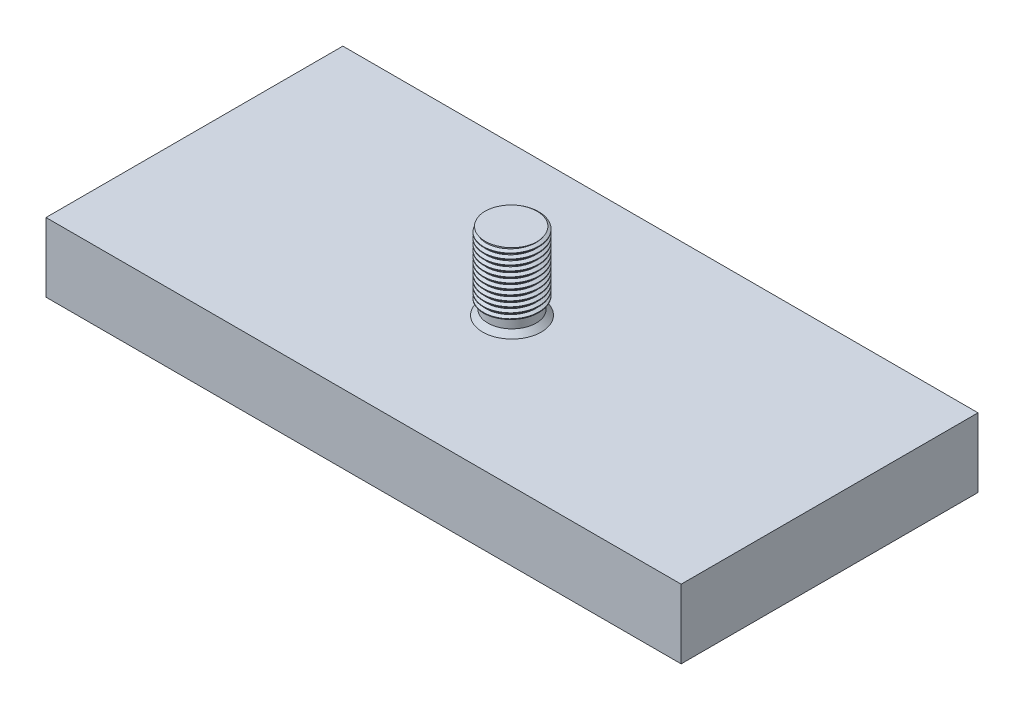
from build123d import *

# Parameters (mm, degrees)
SKETCH1_W          = 184
SKETCH1_H          = 86
PLATE_DEPTH        = 20
SKETCH2_R          = 7
NECK_DEPTH         = 4
SKETCH3_R          = 8
BOLT_DEPTH         = 18
M16_THREAD_PITCH   = 1.5
WELDINGCORNER_SIZE = 1.5


with BuildPart() as part:
    # Sketch1 → plate (new body)
    with BuildSketch(Plane(origin=(0, 0, 0), x_dir=(1, 0, 0), z_dir=(0, 1, 0))):
        Rectangle(SKETCH1_W, SKETCH1_H)
    extrude(amount=PLATE_DEPTH)

    # Sketch2 → neck (add)
    with BuildSketch(Plane(origin=(0, 20, 0), x_dir=(1, 0, 0), z_dir=(0, 1, 0))):
        with Locations(Location((0, 0, 0), (0, 0, 90))):
            Circle(SKETCH2_R)
    extrude(amount=NECK_DEPTH)

    # Sketch3 → bolt (add)
    with BuildSketch(Plane(origin=(0, 24, 0), x_dir=(1, 0, 0), z_dir=(0, 1, 0))):
        with Locations(Location((0, 0, 0), (0, 0, 270))):
            Circle(SKETCH3_R)
    extrude(amount=BOLT_DEPTH)

    # m16 thread: the profile of Thread Profile1 profile screwed along a right-hand helix of 13 turns, 8 arcs to a turn; built about Z, then put on its axis
    m16_thread_z = Axis((0, 0, 0), (0, 0, 1))
    m16_thread_corners = [(8.0003, 0, -0.000173205), (8.0003, 0, 1.312673201), (7.188101188, 0, 0.843749998), (7.188101188, 0, 0.468749998)]
    with BuildLine(mode=Mode.PRIVATE) as m16_thread_profile:
        Line(m16_thread_corners[0], m16_thread_corners[1])
        Line(m16_thread_corners[1], m16_thread_corners[2])
        Line(m16_thread_corners[2], m16_thread_corners[3])
        Line(m16_thread_corners[3], m16_thread_corners[0])
    m16_thread_cap = Face(m16_thread_profile.wire())
    m16_thread_turn_angles = [0, 22.5, 45, 67.5, 90, 112.5, 135, 157.5, 180, 202.5, 225, 247.5, 270, 292.5, 315, 337.5, 360]
    m16_thread_turn_weights = [1, 0.9238795325112867, 1, 0.9238795325112867, 1, 0.9238795325112867, 1, 0.9238795325112867, 1, 0.9238795325112867, 1, 0.9238795325112867, 1, 0.9238795325112867, 1, 0.9238795325112867, 1]
    m16_thread_turn_rails = [Edge.make_bspline([Vector(p[0], p[1], 0).rotate(m16_thread_z, m16_thread_turn_angles[k]) / m16_thread_turn_weights[k] + Vector(0, 0, p[2] + M16_THREAD_PITCH * m16_thread_turn_angles[k] / 360) for k in range(17)], [0, 0, 0, 1, 1, 2, 2, 3, 3, 4, 4, 5, 5, 6, 6, 7, 7, 8, 8, 8], 2, m16_thread_turn_weights) for p in m16_thread_corners]
    m16_thread_turn_sides = [Face.make_surface_from_curves(m16_thread_turn_rails[p[0]], m16_thread_turn_rails[p[1]]) for p in [(0, 1), (1, 2), (2, 3), (3, 0)]]
    m16_thread = Plane(origin=(0, 43.5, 0), x_dir=(-1, 0, 0), z_dir=(0, -1, 0)) * Solid(Shell([*[p.moved(Location((0, 0, M16_THREAD_PITCH * i))) for i in range(13) for p in m16_thread_turn_sides], m16_thread_cap, m16_thread_cap.rotate(m16_thread_z, 4680).moved(Location((0, 0, M16_THREAD_PITCH * 4680 / 360)))]))
    add(m16_thread, mode=Mode.SUBTRACT)

    # weldingCorner
    weldingcorner_edges = [part.edges().sort_by_distance(p)[0] for p in [
        (0, 20, 7),
    ]]
    chamfer(weldingcorner_edges, length=WELDINGCORNER_SIZE)


solid = part.part
